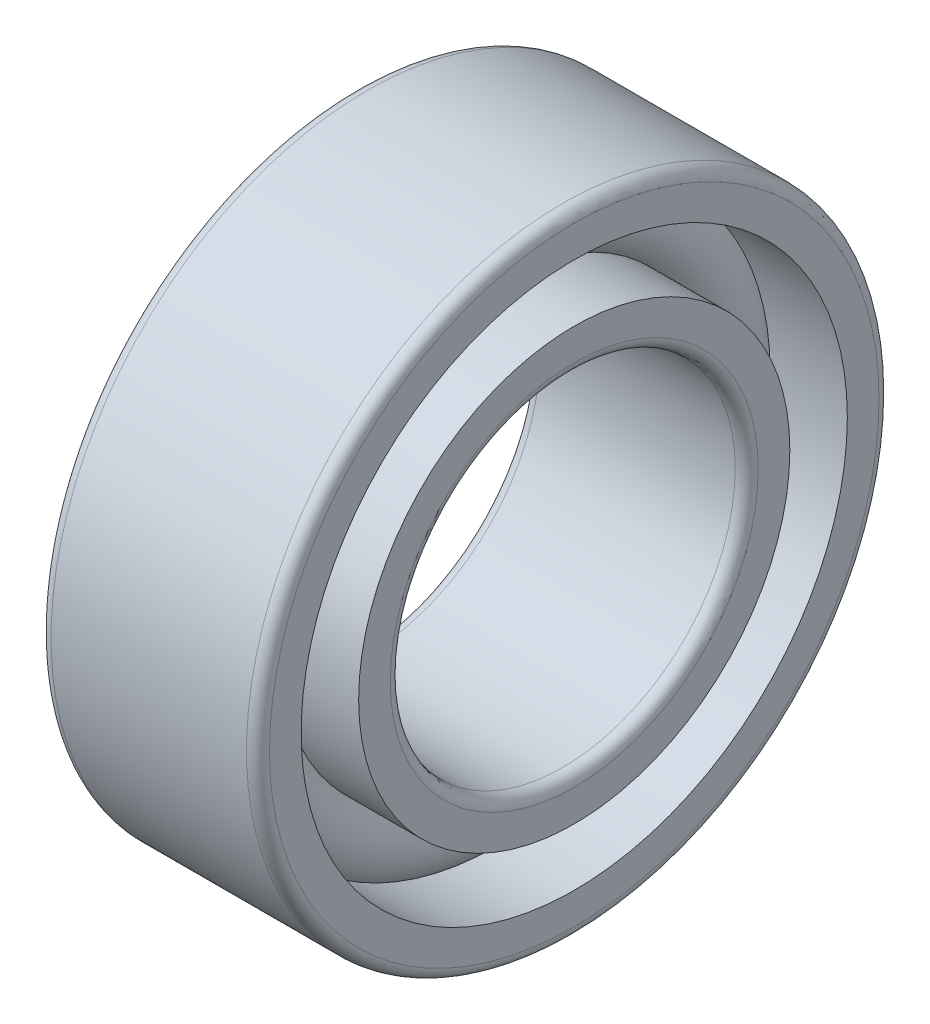
from build123d import *

# Parameters (mm, degrees)
CAGSPISKE_W     = 0.75
CAGSPISKE_H     = 1.25
CAGESPINE_ANGLE = 0.001
BALSIMSKE_R     = 3.75


with BuildPart() as part:
    # CagSpiSke → CageSpine (revolve)
    with BuildSketch(Plane.XY):
        with Locations((0, 21.25)):
            Rectangle(CAGSPISKE_W, CAGSPISKE_H)
    revolve(axis=Axis((-20.6375, 0, 0), (-1, 0, 0)), revolution_arc=CAGESPINE_ANGLE)

    # BalSimSke → BallsSimplified (revolve)
    with BuildSketch(Plane.XY):
        with Locations((0, 21.25)):
            Circle(BALSIMSKE_R)
    revolve(axis=Axis((-10, 0, 0), (1, 0, 0)))

    # InnRacSke → InnerRace (revolve)
    with BuildSketch(Plane.XY):
        with BuildLine():
            Line((-2.761453422, 18.75), (-9.5, 18.75))
            Line((-9.5, 18.75), (-9.5, 16))
            ThreePointArc((-9.5, 16), (-9.207106781, 15.292893219), (-8.5, 15))
            Line((-8.5, 15), (8.5, 15))
            ThreePointArc((8.5, 15), (9.207106781, 15.292893219), (9.5, 16))
            Line((9.5, 16), (9.5, 18.75))
            Line((9.5, 18.75), (2.761453422, 18.75))
            ThreePointArc((2.761453422, 18.75), (0, 17.525), (-2.761453422, 18.75))
        make_face()
    revolve(axis=Axis((-20.6375, 0, 0), (1, 0, 0)))

    # OutRacSke → OuterRace (revolve)
    with BuildSketch(Plane.XY):
        with BuildLine():
            Line((-2.761453422, 23.75), (-9.5, 23.75))
            Line((-9.5, 23.75), (-9.5, 26.5))
            ThreePointArc((-9.5, 26.5), (-9.207106781, 27.207106781), (-8.5, 27.5))
            Line((-8.5, 27.5), (8.5, 27.5))
            ThreePointArc((8.5, 27.5), (9.207106781, 27.207106781), (9.5, 26.5))
            Line((9.5, 26.5), (9.5, 23.75))
            Line((9.5, 23.75), (2.761453422, 23.75))
            ThreePointArc((2.761453422, 23.75), (0, 24.975), (-2.761453422, 23.75))
        make_face()
    revolve(axis=Axis((-20.6375, 0, 0), (1, 0, 0)))


solid = part.part
